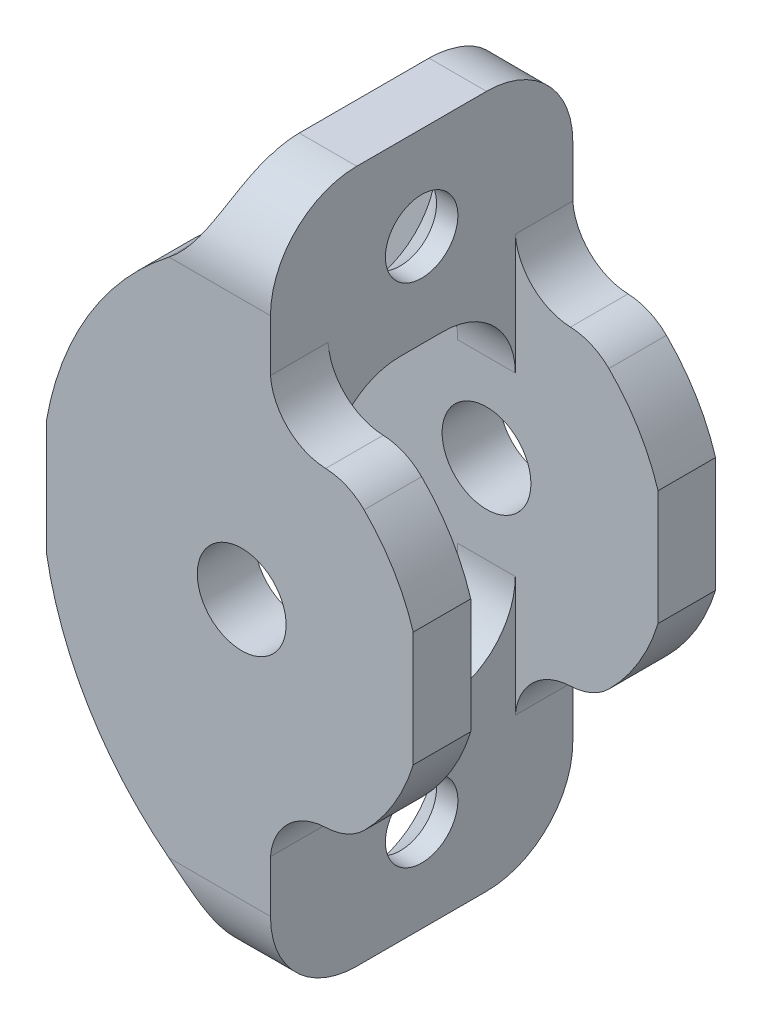
from build123d import *

# Parameters (mm, degrees)
SKETCH2_W                                            = 33.3756
SKETCH2_H                                            = 76.48702
BODY_EXTRUDE_DEPTH                                   = 3.175
ROUND_EXTRUDE_DEPTH                                  = 6.35
SKETCH5_W                                            = 20.6756
SKETCH5_H                                            = 35.3314
RECTANGLE_CUT_DEPTH                                  = 88.03940876
BACK_EDGE_FILLET_R                                   = 12.7
OUTER_FILLET_R                                       = 9.525
INNER_FILLET_R                                       = 7.9375
CSK_FOR_M8_CROSS_COUNTERSUNK_HEAD_SCREW1_D           = 8
CSK_FOR_M8_CROSS_COUNTERSUNK_HEAD_SCREW1_DEPTH       = 33.782
CSK_FOR_M8_CROSS_COUNTERSUNK_HEAD_SCREW1_CSINK_D     = 16
CSK_FOR_M8_CROSS_COUNTERSUNK_HEAD_SCREW1_CSINK_ANGLE = 90
VERTICAL_HOLES_DEPTH                                 = 87.191021329
VERTICAL_HOLES_DEPTH_BACK                            = 87.191021329
SKETCH9_R                                            = 4.9022


with BuildPart() as part:
    # Sketch2 → Body Extrude (new, symmetric)
    with BuildSketch(Plane(origin=(0, 0, 0), x_dir=(0, 0, -1), z_dir=(1, 0, 0))):
        with Locations((16.6878, 38.24351)):
            Rectangle(SKETCH2_W, SKETCH2_H)
    extrude(amount=BODY_EXTRUDE_DEPTH, both=True)

    # Sketch3 → Round Extrude (add)
    with BuildSketch(Plane.XY):
        with BuildLine():
            Line((18.936083517, 44.59351), (18.936083517, 31.89351))
            ThreePointArc((18.936083517, 31.89351), (16.776632986, 27.073011115), (13.511311574, 22.921130557))
            ThreePointArc((13.511311574, 22.921130557), (11.564427885, 21.602067983), (9.271, 21.082))
            ThreePointArc((9.271, 21.082), (4.758252665, 18.954997631), (3.175, 14.224))
            Line((3.175, 14.224), (-3.175, 6.35))
            ThreePointArc((-3.175, 6.35), (-15.275957763, 17.02760796), (-21.556837243, 31.89351))
            Line((-21.556837243, 31.89351), (-21.556837243, 44.59351))
            ThreePointArc((-21.556837243, 44.59351), (-15.275957763, 59.45941204), (-3.175, 70.13702))
            Line((-3.175, 70.13702), (3.175, 62.26302))
            ThreePointArc((3.175, 62.26302), (4.758252665, 57.532022369), (9.271, 55.40502))
            ThreePointArc((9.271, 55.40502), (11.564427885, 54.884952017), (13.511311574, 53.565889443))
            ThreePointArc((13.511311574, 53.565889443), (16.776632986, 49.414008885), (18.936083517, 44.59351))
        make_face()
    round_extrude = extrude(amount=-ROUND_EXTRUDE_DEPTH)

    # Round Extrude Mirrored: Round Extrude across plane
    add(round_extrude.mirror(Plane(origin=(0, 0, -16.6878), x_dir=(1, 0, 0), z_dir=(0, 0, -1))))

    # Sketch5 → Rectangle Cut (cut, through all)
    with BuildSketch(Plane(origin=(3.175, 0, 0), x_dir=(0, 0, -1), z_dir=(1, 0, 0))):
        with Locations((16.6878, 38.24351)):
            Rectangle(SKETCH5_W, SKETCH5_H)
    extrude(amount=-RECTANGLE_CUT_DEPTH, mode=Mode.SUBTRACT)

    # Back Edge Fillet
    # the kernel refuses this fillet: 12.7 mm, written as the material it adds along each edge
    with BuildSketch(Plane(origin=(-3.175, 6.35, -33.3756), x_dir=(-0.8366334248395991, 0.5477631901115323, 0), z_dir=(0, 0, 1)), Plane(origin=(-3.175, 70.13702, 0), x_dir=(-0.8366334248396001, -0.5477631901115311, 0), z_dir=(0, 0, -1))) as back_edge_fillet_piece_1:
        with BuildLine():
            CenterArc((6.881526007, 12.658647204), BACK_EDGE_FILLET_R, 215.339993456, 50.03506631)
            Line((-3.478296257, 5.312622248), (-3.685492702, 5.165701749))
            ThreePointArc((-3.685492702, 5.165701749), (-1.951653019, 2.517179274), (-0.21250489, -0.13913185))
            Line((-0.21250489, -0.13913185), (0.020480732, -0.253172944))
            ThreePointArc((0.020480732, -0.253172944), (2.928744699, -0.135731002), (5.837008667, -0.253172944))
            Line((5.837008667, -0.253172944), (5.857489399, 0))
        make_face()
    extrude(amount=6.35)
    with BuildSketch(Plane(origin=(-3.175, 6.35, 0), x_dir=(-0.8366334248395991, 0.5477631901115323, 0), z_dir=(0, 0, -1)), Plane(origin=(-3.175, 70.13702, -33.3756), x_dir=(-0.8366334248396001, -0.5477631901115311, 0), z_dir=(0, 0, 1))) as back_edge_fillet_piece_2:
        with BuildLine():
            CenterArc((6.881526007, -12.658647204), BACK_EDGE_FILLET_R, 94.624940234, 50.03506631)
            Line((-3.478296257, -5.312622248), (-3.685492702, -5.165701749))
            ThreePointArc((-3.685492702, -5.165701749), (-1.951653019, -2.517179274), (-0.21250489, 0.13913185))
            Line((-0.21250489, 0.13913185), (0.020480732, 0.253172944))
            ThreePointArc((0.020480732, 0.253172944), (2.928744699, 0.135731002), (5.837008667, 0.253172944))
            Line((5.837008667, 0.253172944), (5.857489399, 0))
        make_face()
    extrude(amount=6.35)

    # Outer Fillet
    # the kernel refuses this fillet: 9.525 mm, written as the material it takes off along each edge
    with BuildSketch(Plane(origin=(26.9875, 76.48702, 0), x_dir=(0, 0, -1), z_dir=(-1, 0, 0)), Plane(origin=(-26.9875, 76.48702, -33.3756), x_dir=(0, 0, 1), z_dir=(1, 0, 0)), Plane(origin=(-26.9875, 0, -33.3756), x_dir=(0, 1, 0), z_dir=(1, 0, 0)), Plane(origin=(26.9875, 0, 0), x_dir=(0, 1, 0), z_dir=(-1, 0, 0))) as outer_fillet_piece_1:
        with BuildLine():
            CenterArc((OUTER_FILLET_R, OUTER_FILLET_R), OUTER_FILLET_R, 180, 90)
            Line((0, OUTER_FILLET_R), (0, 0))
            Line((0, 0), (OUTER_FILLET_R, 0))
        make_face()
    extrude(amount=53.975, mode=Mode.SUBTRACT)

    # Inner Fillet
    inner_fillet_edges = [part.edges().sort_by_distance(p)[0] for p in [
        (0, 55.90921, -27.0256),
        (0, 20.57781, -6.35),
        (0, 55.90921, -6.35),
        (0, 20.57781, -27.0256),
    ]]
    fillet(inner_fillet_edges, radius=INNER_FILLET_R)

    # CSK for M8 Cross Countersunk Head Screw1
    with Locations(Plane.ZY.offset(3.175)):
        with Locations((-16.6878, 66.20002), (-16.6878, 10.287)):
            CounterSinkHole(CSK_FOR_M8_CROSS_COUNTERSUNK_HEAD_SCREW1_D / 2, CSK_FOR_M8_CROSS_COUNTERSUNK_HEAD_SCREW1_CSINK_D / 2, depth=CSK_FOR_M8_CROSS_COUNTERSUNK_HEAD_SCREW1_DEPTH, counter_sink_angle=CSK_FOR_M8_CROSS_COUNTERSUNK_HEAD_SCREW1_CSINK_ANGLE)

    # Sketch9 → Vertical Holes (cut, two sides: drawn at the far end of the back side and taken through both)
    with BuildSketch(Plane.XY.offset(-VERTICAL_HOLES_DEPTH_BACK)):
        with Locations((0, 38.24351)):
            Circle(SKETCH9_R)
    extrude(amount=VERTICAL_HOLES_DEPTH + VERTICAL_HOLES_DEPTH_BACK, mode=Mode.SUBTRACT)


solid = part.part
